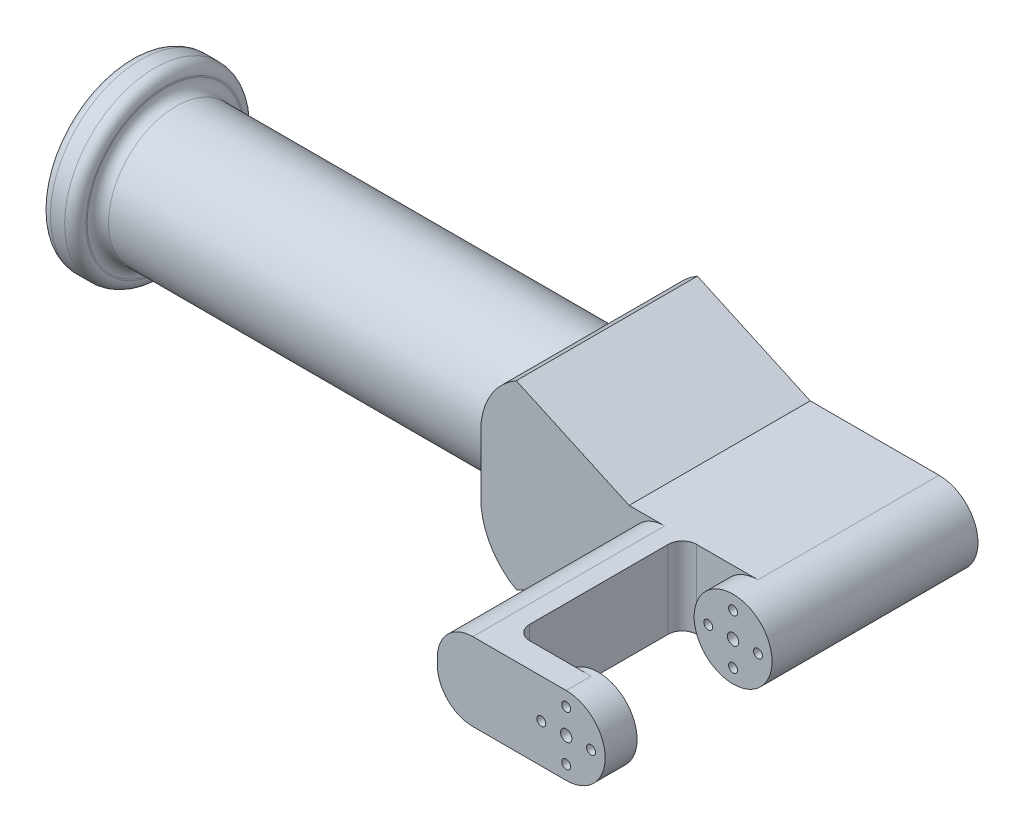
from build123d import *

# Parameters (mm, degrees)
BOSS_EXTRUDE1_DEPTH       = 15
SKETCH2_R                 = 10.97
SKETCH2_R_2               = 1.6
SKETCH2_R_3               = 1.25
BOSS_EXTRUDE2_DEPTH       = 5.89
CUT_EXTRUDE1_START        = -100
SKETCH3_R                 = 1.25
SKETCH3_R_2               = 1.6
CUT_EXTRUDE1_DEPTH        = 100
SKETCH4_W                 = 50
SKETCH4_H                 = 21.94
BOSS_EXTRUDE3_DEPTH       = 49.02
SKETCH9_W                 = 51
SKETCH9_H                 = 51
BOSS_EXTRUDE7_DEPTH       = 10
SKETCH10_R                = 19.05
BOSS_EXTRUDE8_DEPTH       = 114.3
SKETCH11_R                = 25.4
BOSS_EXTRUDE9_DEPTH       = 10
SKETCH12_W                = 15
SKETCH12_H                = 21.94
BOSS_EXTRUDE10_DEPTH      = 30
BOSS_EXTRUDE11_START      = -20.89
SKETCH13_R                = 10.97
SKETCH13_R_2              = 1.6
SKETCH13_R_3              = 1.25
BOSS_EXTRUDE11_DEPTH      = 20.89
CUT_EXTRUDE2_START        = -20.89
SKETCH15_R                = 1.6
SKETCH15_R_2              = 1.25
CUT_EXTRUDE2_DEPTH        = 20.89
SKETCH17_W                = 51
SKETCH17_H                = 51
BOSS_EXTRUDE12_DEPTH      = 79.02
SKETCH18_W                = 30.492655515
SKETCH18_H                = 30.492655514
CUT_EXTRUDE3_DEPTH        = 64
SKETCH19_W                = 15
SKETCH19_H                = 21.94
BOSS_EXTRUDE13_DEPTH      = 29
BOSS_EXTRUDE14_START      = -20.98
SKETCH20_R                = 10.97
SKETCH20_R_2              = 1.6
SKETCH20_R_3              = 1.25
BOSS_EXTRUDE14_DEPTH      = 20.98
CUT_EXTRUDE4_START        = -20.98
SKETCH21_R                = 1.6
SKETCH21_R_2              = 1.25
CUT_EXTRUDE4_DEPTH        = 20.98
SKETCH23_W                = 42.482123656
SKETCH23_H                = 33.824616935
CUT_EXTRUDE6_DEPTH        = 100
FILLET6_R                 = 3
FILLET7_R                 = 3
CUT_EXTRUDE16_DEPTH       = 100
FILLET9_R                 = 20
FILLET10_R                = 20
SKETCH45_W                = 15
SKETCH45_H                = 21.94
BOSS_EXTRUDE19_DEPTH      = 54
SKETCH46_W                = 7
SKETCH46_H                = 21.94
BOSS_EXTRUDE20_DEPTH      = 21.27589
BOSS_EXTRUDE21_DEPTH      = 2
BOSS_EXTRUDE21_DEPTH_BACK = 7
SKETCH47_R                = 10.97
FILLET11_R                = 10
FILLET12_R                = 4
BOSS_EXTRUDE22_START      = 7
SKETCH50_R                = 10.97
BOSS_EXTRUDE22_DEPTH      = 7
CUT_EXTRUDE18_DEPTH       = 149.494915794
CUT_EXTRUDE18_DEPTH_BACK  = 149.494915794
SKETCH51_R                = 1.6
SKETCH51_R_2              = 1.25


with BuildPart() as part:
    # Sketch1 → Boss-Extrude1 (new body)
    with BuildSketch(Plane(origin=(0, 0, 0), x_dir=(0, 0, -1), z_dir=(1, 0, 0))):
        with BuildLine():
            Line((0, 10.97), (80, 10.97))
            Line((80, 10.97), (80, -10.97))
            Line((80, -10.97), (0, -10.97))
            ThreePointArc((0, -10.97), (-10.97, 0), (0, 10.97))
        make_face()
    extrude(amount=BOSS_EXTRUDE1_DEPTH)

    # Sketch2 → Boss-Extrude2 (add)
    with BuildSketch(Plane(origin=(15, 0, 0), x_dir=(0, 0, -1), z_dir=(1, 0, 0))):
        with Locations(Location((0, 0, 0), (0, 0, 270))):
            Circle(SKETCH2_R)
        Circle(SKETCH2_R_2, mode=Mode.SUBTRACT)
        with Locations((0, 6.58)):
            Circle(SKETCH2_R_3, mode=Mode.SUBTRACT)
        with Locations((6.58, 0)):
            Circle(SKETCH2_R_3, mode=Mode.SUBTRACT)
        with Locations((0, -6.58)):
            Circle(SKETCH2_R_3, mode=Mode.SUBTRACT)
        with Locations((-6.58, 0)):
            Circle(SKETCH2_R_3, mode=Mode.SUBTRACT)
    extrude(amount=BOSS_EXTRUDE2_DEPTH)

    # Sketch3 → Cut-Extrude1 (cut)
    with BuildSketch(Plane(origin=(20.89, 0, 0), x_dir=(0, 0, -1), z_dir=(1, 0, 0)).offset(CUT_EXTRUDE1_START)):
        with Locations((0, 6.58)):
            Circle(SKETCH3_R)
        Circle(SKETCH3_R_2)
        with Locations((0, -6.58)):
            Circle(SKETCH3_R)
        with Locations((-6.58, 0)):
            Circle(SKETCH3_R)
        with Locations((6.58, 0)):
            Circle(SKETCH3_R)
    extrude(amount=CUT_EXTRUDE1_DEPTH, mode=Mode.SUBTRACT)

    # Sketch4 → Boss-Extrude3 (add)
    with BuildSketch(Plane(origin=(15, 0, 0), x_dir=(0, 0, -1), z_dir=(1, 0, 0))):
        with Locations((55, 0)):
            Rectangle(SKETCH4_W, SKETCH4_H)
    extrude(amount=BOSS_EXTRUDE3_DEPTH)

    # Sketch9 → Boss-Extrude7 (add)
    with BuildSketch(Plane.ZY):
        with Locations((-54.5, 0)):
            Rectangle(SKETCH9_W, SKETCH9_H)
    extrude(amount=BOSS_EXTRUDE7_DEPTH)

    # Sketch10 → Boss-Extrude8 (add)
    with BuildSketch(Plane.ZY.offset(10)):
        with Locations((-54.5, 0)):
            Circle(SKETCH10_R)
    extrude(amount=BOSS_EXTRUDE8_DEPTH)

    # Sketch11 → Boss-Extrude9 (add)
    with BuildSketch(Plane.ZY.offset(124.3)):
        with Locations((-54.5, 0)):
            Circle(SKETCH11_R)
    extrude(amount=BOSS_EXTRUDE9_DEPTH)

    # Sketch12 → Boss-Extrude10 (add)
    with BuildSketch(Plane.XY.offset(-30)):
        with Locations((56.52, 0)):
            Rectangle(SKETCH12_W, SKETCH12_H)
    extrude(amount=BOSS_EXTRUDE10_DEPTH)

    # Sketch13 → Boss-Extrude11 (add)
    with BuildSketch(Plane(origin=(64.02, 0, 0), x_dir=(0, 0, -1), z_dir=(1, 0, 0)).offset(BOSS_EXTRUDE11_START)):
        with Locations(Location((0, 0, 0), (0, 0, 270))):
            Circle(SKETCH13_R)
        Circle(SKETCH13_R_2, mode=Mode.SUBTRACT)
        with Locations((6.58, 0)):
            Circle(SKETCH13_R_3, mode=Mode.SUBTRACT)
        with Locations((0, 6.58)):
            Circle(SKETCH13_R_3, mode=Mode.SUBTRACT)
        with Locations((0, -6.58)):
            Circle(SKETCH13_R_3, mode=Mode.SUBTRACT)
        with Locations((-6.58, 0)):
            Circle(SKETCH13_R_3, mode=Mode.SUBTRACT)
    extrude(amount=BOSS_EXTRUDE11_DEPTH)

    # Sketch15 → Cut-Extrude2 (cut)
    with BuildSketch(Plane(origin=(64.02, 0, 0), x_dir=(0, 0, -1), z_dir=(1, 0, 0)).offset(CUT_EXTRUDE2_START)):
        Circle(SKETCH15_R)
        with Locations((0, 6.58)):
            Circle(SKETCH15_R_2)
        with Locations((6.58, 0)):
            Circle(SKETCH15_R_2)
        with Locations((0, -6.58)):
            Circle(SKETCH15_R_2)
        with Locations((-6.58, 0)):
            Circle(SKETCH15_R_2)
    extrude(amount=CUT_EXTRUDE2_DEPTH, mode=Mode.SUBTRACT)

    # Sketch17 → Boss-Extrude12 (add)
    with BuildSketch(Plane(origin=(0, 0, 0), x_dir=(0, 0, -1), z_dir=(1, 0, 0))):
        with Locations((54.5, 0)):
            Rectangle(SKETCH17_W, SKETCH17_H)
    extrude(amount=BOSS_EXTRUDE12_DEPTH)

    # Sketch18 → Cut-Extrude3 (cut)
    with BuildSketch(Plane.XY.offset(-29)):
        with Locations((54.797648863, -1.842094242)):
            Rectangle(SKETCH18_W, SKETCH18_H)
    extrude(amount=CUT_EXTRUDE3_DEPTH, mode=Mode.SUBTRACT)

    # Sketch19 → Boss-Extrude13 (add)
    with BuildSketch(Plane.XY.offset(-29)):
        with Locations((71.52, 0)):
            Rectangle(SKETCH19_W, SKETCH19_H)
    extrude(amount=BOSS_EXTRUDE13_DEPTH)

    # Sketch20 → Boss-Extrude14 (add)
    with BuildSketch(Plane(origin=(79.02, 0, 0), x_dir=(0, 0, -1), z_dir=(1, 0, 0)).offset(BOSS_EXTRUDE14_START)):
        with Locations(Location((0, 0, 0), (0, 0, 270))):
            Circle(SKETCH20_R)
        Circle(SKETCH20_R_2, mode=Mode.SUBTRACT)
        with Locations((0, 6.58)):
            Circle(SKETCH20_R_3, mode=Mode.SUBTRACT)
        with Locations((6.58, 0)):
            Circle(SKETCH20_R_3, mode=Mode.SUBTRACT)
        with Locations((0, -6.58)):
            Circle(SKETCH20_R_3, mode=Mode.SUBTRACT)
        with Locations((-6.58, 0)):
            Circle(SKETCH20_R_3, mode=Mode.SUBTRACT)
    extrude(amount=BOSS_EXTRUDE14_DEPTH)

    # Sketch21 → Cut-Extrude4 (cut)
    with BuildSketch(Plane(origin=(79.02, 0, 0), x_dir=(0, 0, -1), z_dir=(1, 0, 0)).offset(CUT_EXTRUDE4_START)):
        Circle(SKETCH21_R)
        with Locations((0, 6.58)):
            Circle(SKETCH21_R_2)
        with Locations((6.58, 0)):
            Circle(SKETCH21_R_2)
        with Locations((0, -6.58)):
            Circle(SKETCH21_R_2)
        with Locations((-6.58, 0)):
            Circle(SKETCH21_R_2)
    extrude(amount=CUT_EXTRUDE4_DEPTH, mode=Mode.SUBTRACT)

    # Sketch23 → Cut-Extrude6 (cut)
    with BuildSketch(Plane(origin=(79.02, 0, 0), x_dir=(0, 0, -1), z_dir=(1, 0, 0))):
        with Locations((7.758938172, -1.322691532)):
            Rectangle(SKETCH23_W, SKETCH23_H)
    extrude(amount=-CUT_EXTRUDE6_DEPTH, mode=Mode.SUBTRACT)

    # Fillet6
    fillet6_edges = [part.edges().sort_by_distance(p)[0] for p in [
        (-124.3, 0, -73.55),
        (-124.3, 0, -79.9),
    ]]
    fillet(fillet6_edges, radius=FILLET6_R)

    # Fillet7
    fillet7_edges = [part.edges().sort_by_distance(p)[0] for p in [
        (-134.3, 0, -79.9),
    ]]
    fillet(fillet7_edges, radius=FILLET7_R)

    # Sketch41 → Cut-Extrude16 (cut)
    with BuildSketch(Plane.XY.offset(-29)):
        with BuildLine():
            Line((79.02, 25.5), (0, 25.5))
            Line((0, 25.5), (31.774109721, 10.97))
            Line((31.774109721, 10.97), (68.05, 10.97))
            ThreePointArc((68.05, 10.97), (75.80696139, 7.75696139), (79.02, 0))
            Line((79.02, 0), (79.02, 25.5))
        make_face()
        with BuildLine():
            Line((31.774109721, -10.97), (0, -25.5))
            Line((0, -25.5), (79.02, -25.5))
            Line((79.02, -25.5), (79.02, 0))
            ThreePointArc((79.02, 0), (75.80696139, -7.75696139), (68.05, -10.97))
            Line((68.05, -10.97), (31.774109721, -10.97))
        make_face()
    extrude(amount=-CUT_EXTRUDE16_DEPTH, mode=Mode.SUBTRACT)

    # Fillet9
    # the kernel refuses this fillet: 20 mm, written as the material it takes off along each edge
    with BuildSketch(Plane(origin=(-10, 25.5, -123.301270189), x_dir=(0, -1, 0), z_dir=(0, 0, 1))) as fillet9_piece_1_section:
        with BuildLine():
            CenterArc((17.320508076, 20), FILLET9_R, 210, 60)
            Line((0, 10), (0, 0))
            Line((0, 0), (17.320508076, 0))
        make_face()
    fillet9_piece_1 = extrude(amount=137.602540378, mode=Mode.PRIVATE)
    fillet9_piece_1 = fillet9_piece_1 - Plane(origin=(-10, 0, -54.5), x_dir=(0, 0, 1), z_dir=(1, 0, 0)) * Cylinder(19.05, 345, mode=Mode.PRIVATE)
    add(fillet9_piece_1, mode=Mode.SUBTRACT)

    # Fillet10
    # the kernel refuses this fillet: 20 mm, written as the material it takes off along each edge
    with BuildSketch(Plane(origin=(-10, -25.5, 14.301270189), x_dir=(0, 1, 0), z_dir=(0, 0, -1))) as fillet10_piece_1_section:
        with BuildLine():
            CenterArc((17.320508076, 20), FILLET10_R, 210, 60)
            Line((0, 10), (0, 0))
            Line((0, 0), (17.320508076, 0))
        make_face()
    fillet10_piece_1 = extrude(amount=137.602540378, mode=Mode.PRIVATE)
    fillet10_piece_1 = fillet10_piece_1 - Plane(origin=(-10, 0, -54.5), x_dir=(0, 0, 1), z_dir=(1, 0, 0)) * Cylinder(19.05, 345, mode=Mode.PRIVATE)
    add(fillet10_piece_1, mode=Mode.SUBTRACT)

    # Sketch45 → Boss-Extrude19 (add)
    with BuildSketch(Plane.XY.offset(-29)):
        with Locations((39.274109721, 0)):
            Rectangle(SKETCH45_W, SKETCH45_H)
    extrude(amount=BOSS_EXTRUDE19_DEPTH)

    # Sketch46 → Boss-Extrude20 (add)
    with BuildSketch(Plane(origin=(46.774109721, 0, 0), x_dir=(0, 0, -1), z_dir=(1, 0, 0))):
        with Locations((-21.5, 0)):
            Rectangle(SKETCH46_W, SKETCH46_H)
    extrude(amount=BOSS_EXTRUDE20_DEPTH)

    # Sketch47 → Boss-Extrude21 (add, two sides: drawn at the far end of the back side and taken through both)
    with BuildSketch(Plane(origin=(0, 0, 18), x_dir=(-1, 0, 0), z_dir=(0, 0, -1)).offset(-BOSS_EXTRUDE21_DEPTH_BACK)):
        with Locations(Location((-68.05, 0, 0), (0, 0, 90))):
            Circle(SKETCH47_R)
    extrude(amount=BOSS_EXTRUDE21_DEPTH + BOSS_EXTRUDE21_DEPTH_BACK)

    # Fillet11
    fillet11_edges = [part.edges().sort_by_distance(p)[0] for p in [
        (31.774109721, 10.97, -2),
        (31.774109721, -10.97, -2),
    ]]
    fillet(fillet11_edges, radius=FILLET11_R)

    # Fillet12
    fillet12_edges = [part.edges().sort_by_distance(p)[0] for p in [
        (46.774109721, 0, -29),
        (46.774109721, 0, 18),
    ]]
    fillet(fillet12_edges, radius=FILLET12_R)

    # Sketch50 → Boss-Extrude22 (add)
    with BuildSketch(Plane.XY.offset(-29).offset(BOSS_EXTRUDE22_START)):
        with Locations((68.05, 0)):
            Circle(SKETCH50_R)
    extrude(amount=-BOSS_EXTRUDE22_DEPTH)

    # Sketch51 → Cut-Extrude18 (cut, two sides: drawn at the far end of the back side and taken through both)
    with BuildSketch(Plane.XY.offset(-22).offset(-CUT_EXTRUDE18_DEPTH_BACK)):
        with Locations((68.05, 0)):
            Circle(SKETCH51_R)
        with Locations((68.05, 7)):
            Circle(SKETCH51_R_2)
        with Locations((75.05, 0)):
            Circle(SKETCH51_R_2)
        with Locations((68.05, -7)):
            Circle(SKETCH51_R_2)
        with Locations((61.05, 0)):
            Circle(SKETCH51_R_2)
    extrude(amount=CUT_EXTRUDE18_DEPTH + CUT_EXTRUDE18_DEPTH_BACK, mode=Mode.SUBTRACT)


solid = part.part
